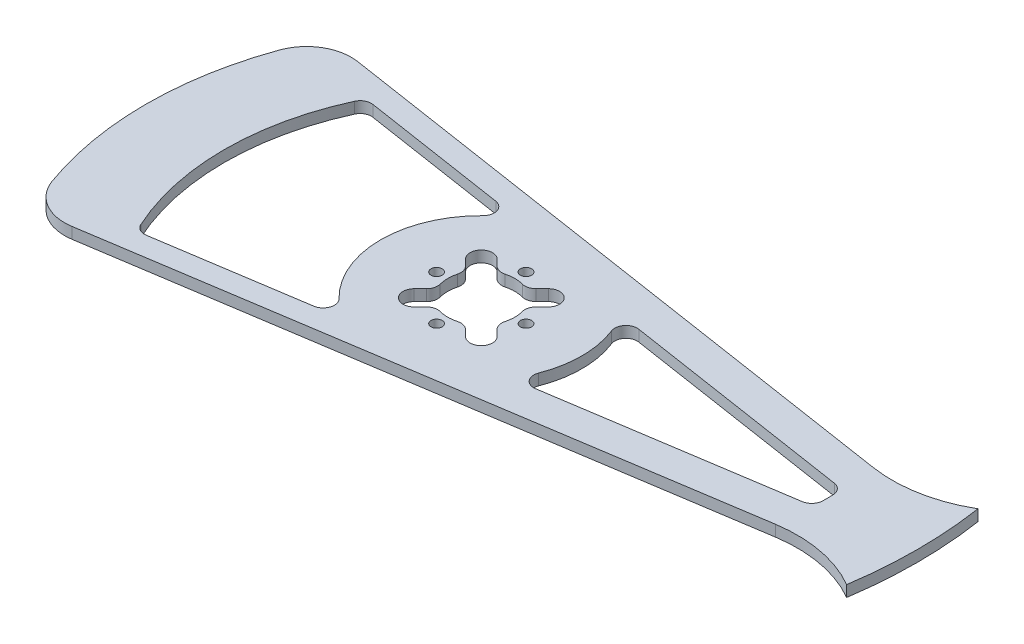
from build123d import *

# Parameters (mm, degrees)
BOSS_EXTRUDE1_DEPTH = 6.35
FILLET1_R           = 6.35
FILLET2_R           = 25.4
FILLET3_R           = 6.35
SKETCH2_R           = 3.175
CUT_EXTRUDE1_DEPTH  = 261.770480457


with BuildPart() as part:
    # Sketch1 → Boss-Extrude1 (new body)
    with BuildSketch(Plane(origin=(0, 0, 0), x_dir=(1, 0, 0), z_dir=(0, 1, 0))):
        with BuildLine():
            Line((194.872934042, 27.82915877), (-170.916556976, 84.129546246))
            ThreePointArc((-170.916556976, 84.129546246), (-190.5, 0), (-170.916556976, -84.129546246))
            Line((-170.916556976, -84.129546246), (194.872934042, -27.82915877))
            ThreePointArc((194.872934042, -27.82915877), (220.662117475, -28.27659702), (244.824613145, -37.301894031))
            ThreePointArc((244.824613145, -37.301894031), (247.65, 0), (244.824613145, 37.301894031))
            ThreePointArc((244.824613145, 37.301894031), (220.662117475, 28.27659702), (194.872934042, 27.82915877))
        make_face()
        with BuildLine():
            ThreePointArc((-130.60870167, -65.076024595), (-145.923, 0), (-130.60870167, 65.076024595))
            Line((-130.60870167, 65.076024595), (-28.741073501, 49.39709702))
            ThreePointArc((-28.741073501, 49.39709702), (-57.15, 0), (-28.741073501, -49.39709702))
            Line((-28.741073501, -49.39709702), (-130.60870167, -65.076024595))
        make_face(mode=Mode.SUBTRACT)
        with BuildLine():
            Line((-17.190128061, 8.209871939), (-23.540128061, 14.559871939))
            ThreePointArc((-23.540128061, 14.559871939), (-23.540128061, 23.540128061), (-14.559871939, 23.540128061))
            Line((-14.559871939, 23.540128061), (-8.209871939, 17.190128061))
            ThreePointArc((-8.209871939, 17.190128061), (0, 19.05), (8.209871939, 17.190128061))
            Line((8.209871939, 17.190128061), (14.559871939, 23.540128061))
            ThreePointArc((14.559871939, 23.540128061), (21.480039796, 24.916635031), (25.4, 19.05))
            ThreePointArc((25.4, 19.05), (24.916635031, 16.619960204), (23.540128061, 14.559871939))
            Line((23.540128061, 14.559871939), (17.190128061, 8.209871939))
            ThreePointArc((17.190128061, 8.209871939), (18.579214724, 4.20895239), (19.05, 0))
            ThreePointArc((19.05, 0), (18.579214724, -4.20895239), (17.190128061, -8.209871939))
            Line((17.190128061, -8.209871939), (23.540128061, -14.559871939))
            ThreePointArc((23.540128061, -14.559871939), (24.916635031, -16.619960204), (25.4, -19.05))
            ThreePointArc((25.4, -19.05), (21.480039796, -24.916635031), (14.559871939, -23.540128061))
            Line((14.559871939, -23.540128061), (8.209871939, -17.190128061))
            ThreePointArc((8.209871939, -17.190128061), (0, -19.05), (-8.209871939, -17.190128061))
            Line((-8.209871939, -17.190128061), (-14.559871939, -23.540128061))
            ThreePointArc((-14.559871939, -23.540128061), (-23.540128061, -23.540128061), (-23.540128061, -14.559871939))
            Line((-23.540128061, -14.559871939), (-17.190128061, -8.209871939))
            ThreePointArc((-17.190128061, -8.209871939), (-19.05, 0), (-17.190128061, 8.209871939))
        make_face(mode=Mode.SUBTRACT)
        with BuildLine():
            ThreePointArc((47.897230141, -31.17655922), (57.15, 0), (47.897230141, 31.17655922))
            Line((47.897230141, 31.17655922), (196.675896516, 8.277332285))
            ThreePointArc((196.675896516, 8.277332285), (196.85, 0), (196.675896516, -8.277332285))
            Line((196.675896516, -8.277332285), (47.897230141, -31.17655922))
        make_face(mode=Mode.SUBTRACT)
    extrude(amount=BOSS_EXTRUDE1_DEPTH)

    # Fillet1
    fillet1_edges = [part.edges().sort_by_distance(p)[0] for p in [
        (47.897230141, 3.175, 31.17655922),
        (47.897230141, 3.175, -31.17655922),
        (196.675896516, 3.175, -8.277332285),
        (196.675896516, 3.175, 8.277332285),
        (-130.60870167, 3.175, -65.076024595),
        (-130.60870167, 3.175, 65.076024595),
        (-28.741073501, 3.175, -49.39709702),
        (-28.741073501, 3.175, 49.39709702),
    ]]
    fillet(fillet1_edges, radius=FILLET1_R)

    # Fillet2
    fillet2_edges = [part.edges().sort_by_distance(p)[0] for p in [
        (-170.916556976, 3.175, -84.129546246),
        (-170.916556976, 3.175, 84.129546246),
    ]]
    fillet(fillet2_edges, radius=FILLET2_R)

    # Fillet3
    fillet3_edges = [part.edges().sort_by_distance(p)[0] for p in [
        (-8.209871939, 3.175, 17.190128061),
        (8.209871939, 3.175, 17.190128061),
        (17.190128061, 3.175, 8.209871939),
        (17.190128061, 3.175, -8.209871939),
        (-8.209871939, 3.175, -17.190128061),
        (8.209871939, 3.175, -17.190128061),
        (-17.190128061, 3.175, -8.209871939),
        (-17.190128061, 3.175, 8.209871939),
    ]]
    fillet(fillet3_edges, radius=FILLET3_R)

    # Sketch2 → Cut-Extrude1 (cut, through all)
    with BuildSketch(Plane(origin=(0, 6.35, 0), x_dir=(1, 0, 0), z_dir=(0, 1, 0))):
        with Locations((0, 25.4)):
            Circle(SKETCH2_R)
        with Locations((25.4, 0)):
            Circle(SKETCH2_R)
        with Locations((0, -25.4)):
            Circle(SKETCH2_R)
        with Locations((-25.4, 0)):
            Circle(SKETCH2_R)
    extrude(amount=-CUT_EXTRUDE1_DEPTH, mode=Mode.SUBTRACT)


solid = part.part
